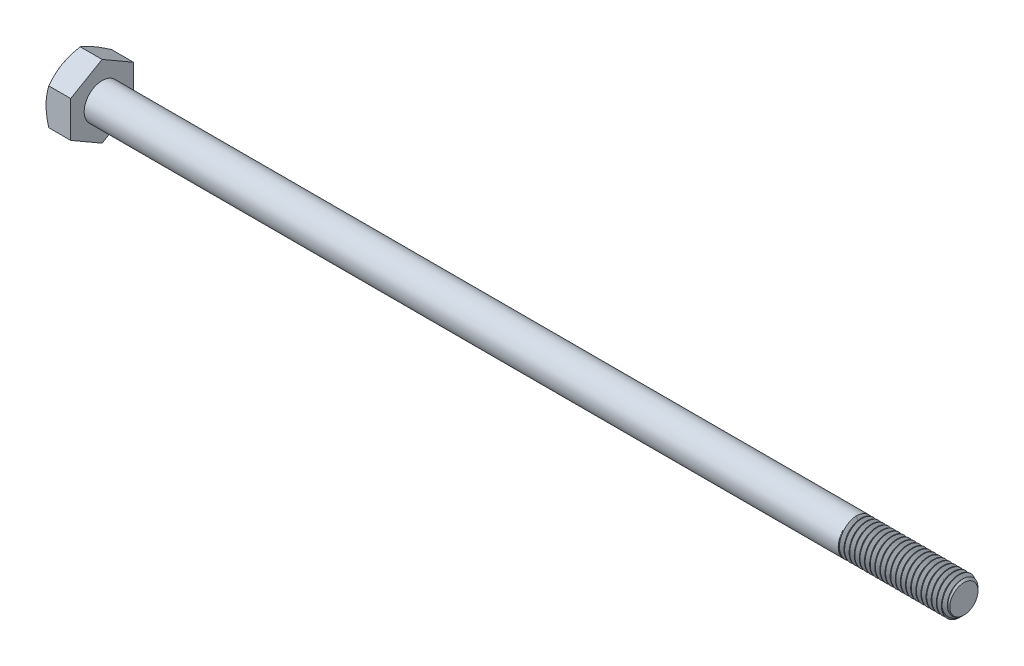
from build123d import *

# Parameters (mm, degrees)
SKETCH5_R           = 3.175
BOSS_EXTRUDE3_DEPTH = 152.4
CHAMFER1_SIZE       = 0.680357143
BOSS_EXTRUDE4_DEPTH = 4.365625
SKETCH8_OUTSIDE_W   = 591.96
SKETCH8_OUTSIDE_H   = 593.68
SKETCH8_OUTSIDE_R   = 5.55625
CUT_EXTRUDE3_DEPTH  = 157.995208996
CUT_EXTRUDE3_DRAFT  = -60
CUT_EXTRUDE4_DEPTH  = 0.254
CIRPATTERN1_COUNT   = 6
CUT_SWEEP1_PITCH    = 0.907142857
CUT_SWEEP1_TO       = 19.05


with BuildPart() as part:
    # Sketch5 → Boss-Extrude3 (new body)
    with BuildSketch(Plane(origin=(78.3828125, 0, 0), x_dir=(0, 0, -1), z_dir=(1, 0, 0))):
        Circle(SKETCH5_R)
    extrude(amount=-BOSS_EXTRUDE3_DEPTH)

    # Chamfer1
    chamfer1_edges = [part.edges().sort_by_distance(p)[0] for p in [
        (78.3828125, 0, 3.175),
    ]]
    chamfer(chamfer1_edges, length=CHAMFER1_SIZE)

    # Sketch11 → Revolve1 (revolve)
    with BuildSketch(Plane.XY):
        Polygon((-74.0171875, 3.175), (-74.0171875, 0), (62.5078125, 0), (59.3328125, 3.175), align=None)
    revolve(axis=Axis((-74.0171875, 0, 0), (1, 0, 0)))

    # Sketch6 → Boss-Extrude4 (add)
    with BuildSketch(Plane.ZY.offset(74.0171875)):
        Polygon((5.55625, 3.207902433), (0, 6.415804866), (-5.55625, 3.207902433), (-5.55625, -3.207902433), (0, -6.415804866), (5.55625, -3.207902433), align=None)
    extrude(amount=BOSS_EXTRUDE4_DEPTH)


with BuildPart() as cut_extrude3_tool:
    # Sketch8 outside → Cut-Extrude3 (with draft: the straight prism first)
    with BuildSketch(Plane.ZY.offset(78.3828125)):
        Rectangle(SKETCH8_OUTSIDE_W, SKETCH8_OUTSIDE_H)
        Circle(SKETCH8_OUTSIDE_R, mode=Mode.SUBTRACT)
    extrude(amount=-CUT_EXTRUDE3_DEPTH)
    # Cut-Extrude3: the draft: its side faces are tilted about the plane it starts from
    cut_extrude3_sides = [cut_extrude3_tool.faces().sort_by_distance(p)[0] for p in [
        (0.614791998, -296.84, 0),
        (0.614791998, 0, 295.98),
        (0.614791998, 296.84, 0),
        (0.614791998, 0, -295.98),
        (0.614791998, 0, -5.55625),
    ]]
    draft(cut_extrude3_sides, Plane.ZY.offset(78.3828125), CUT_EXTRUDE3_DRAFT)


with BuildPart() as part_1:
    add(part.part)

    # Cut-Extrude3: cut by cut_extrude3_tool
    add(cut_extrude3_tool.part, mode=Mode.SUBTRACT)

    # Sketch12 → Cut-Extrude4 (cut)
    with BuildSketch(Plane.ZY.offset(78.3828125)):
        with BuildLine():
            Line((0.1666875, 4.2783125), (0.1666875, 2.3891875))
            ThreePointArc((0.1666875, 2.3891875), (0, 2.2225), (-0.1666875, 2.3891875))
            Line((-0.1666875, 2.3891875), (-0.1666875, 4.2783125))
            ThreePointArc((-0.1666875, 4.2783125), (0, 4.445), (0.1666875, 4.2783125))
        make_face()
    cut_extrude4 = extrude(amount=-CUT_EXTRUDE4_DEPTH, mode=Mode.SUBTRACT)

    # CirPattern1: Cut-Extrude4 ×6 about axis
    cirpattern1_axis = Axis((0, 0, 0), (1, 0, 0))
    for i in range(1, CIRPATTERN1_COUNT):
        add(cut_extrude4.rotate(cirpattern1_axis, i * 360 / CIRPATTERN1_COUNT), mode=Mode.SUBTRACT)


with BuildPart() as body_2:
    # Split1: the piece on the far side of the plane
    add(part_1.part)
    split(bisect_by=Plane(origin=(59.3328125, 0, 0), x_dir=(0, 0, 1), z_dir=(1, 0, 0)), keep=Keep.BOTTOM)


with BuildPart() as part_2:
    add(part_1.part)

    # Split1
    split(bisect_by=Plane(origin=(59.3328125, 0, 0), x_dir=(0, 0, 1), z_dir=(1, 0, 0)), keep=Keep.TOP)

    # Cut-Sweep1: arcs per turn and ends read off the stored shape
    # Cut-Sweep1: the profile of Sketch10 profile screwed along a right-hand helix through 22 turns, 8 arcs to a turn; built about Z, then put on its axis
    cut_sweep1_z = Axis((0, 0, 0), (0, 0, 1))
    cut_sweep1_corners = [(3.1753, 0, 0.000173205), (2.585793431, 0, -0.340178571), (2.585793431, 0, -0.453571429), (3.1753, 0, -0.793923205)]
    with BuildLine(mode=Mode.PRIVATE) as cut_sweep1_profile:
        Line(cut_sweep1_corners[0], cut_sweep1_corners[1])
        Line(cut_sweep1_corners[1], cut_sweep1_corners[2])
        Line(cut_sweep1_corners[2], cut_sweep1_corners[3])
        Line(cut_sweep1_corners[3], cut_sweep1_corners[0])
    cut_sweep1_cap = Face(cut_sweep1_profile.wire())
    cut_sweep1_turn_angles = [0, 22.5, 45, 67.5, 90, 112.5, 135, 157.5, 180, 202.5, 225, 247.5, 270, 292.5, 315, 337.5, 360]
    cut_sweep1_turn_weights = [1, 0.9238795325112867, 1, 0.9238795325112867, 1, 0.9238795325112867, 1, 0.9238795325112867, 1, 0.9238795325112867, 1, 0.9238795325112867, 1, 0.9238795325112867, 1, 0.9238795325112867, 1]
    cut_sweep1_turn_rails = [Edge.make_bspline([Vector(p[0], p[1], 0).rotate(cut_sweep1_z, cut_sweep1_turn_angles[k]) / cut_sweep1_turn_weights[k] + Vector(0, 0, p[2] + CUT_SWEEP1_PITCH * cut_sweep1_turn_angles[k] / 360) for k in range(17)], [0, 0, 0, 1, 1, 2, 2, 3, 3, 4, 4, 5, 5, 6, 6, 7, 7, 8, 8, 8], 2, cut_sweep1_turn_weights) for p in cut_sweep1_corners]
    cut_sweep1_turn_sides = [Face.make_surface_from_curves(cut_sweep1_turn_rails[p[0]], cut_sweep1_turn_rails[p[1]]) for p in [(0, 1), (1, 2), (2, 3), (3, 0)]]
    cut_sweep1 = Plane(origin=(78.3828125, 0, 0), x_dir=(0, 1, 0), z_dir=(-1, 0, 0)) * split(Solid(Shell([*[p.moved(Location((0, 0, CUT_SWEEP1_PITCH * i))) for i in range(22) for p in cut_sweep1_turn_sides], cut_sweep1_cap, cut_sweep1_cap.rotate(cut_sweep1_z, 7920).moved(Location((0, 0, CUT_SWEEP1_PITCH * 7920 / 360)))])), bisect_by=Plane.XY.offset(CUT_SWEEP1_TO), keep=Keep.BOTTOM, mode=Mode.PRIVATE)
    add(cut_sweep1, mode=Mode.SUBTRACT)

    add(body_2.part)  # Boss-Extrude5 merges body 2
    # Boss-Extrude5: read off the stored shape, not the designer's step
    # Boss-Extrude5 outline → Boss-Extrude5 (revolve)
    with BuildSketch(Plane.YX):
        Polygon((3.175, 59.3328125), (2.585782662, 59.672997289), (2.585782662, 59.3328125), align=None)
    revolve(axis=Axis((0, 0, 0), (1, 0, 0)))


solid = part_2.part
